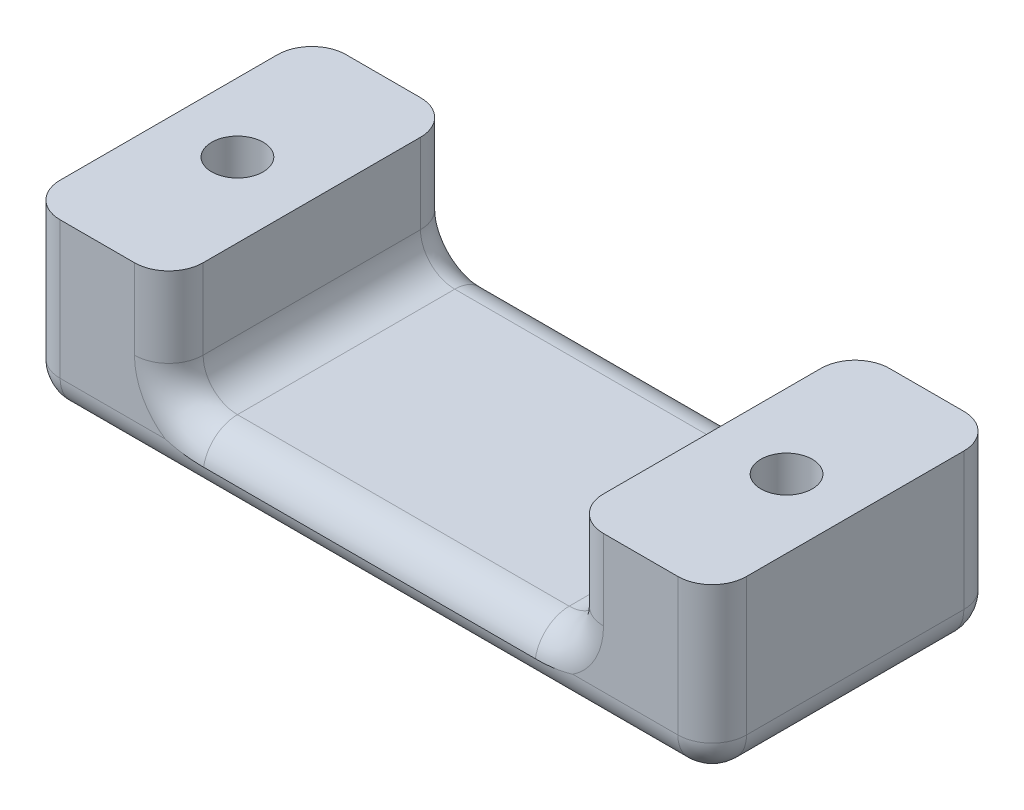
from build123d import *

# Parameters (mm, degrees)
SKETCH1_W           = 60
SKETCH1_H           = 25
BOSS_EXTRUDE1_DEPTH = 5
SKETCH2_W           = 12.5
SKETCH2_H           = 25
BOSS_EXTRUDE2_DEPTH = 10
SKETCH3_R           = 2.25
CUT_EXTRUDE1_DEPTH  = 15
FILLET1_R           = 3


with BuildPart() as part:
    # Sketch1 → Boss-Extrude1 (new body)
    with BuildSketch(Plane(origin=(0, 0, 0), x_dir=(1, 0, 0), z_dir=(0, 1, 0))):
        with Locations((30, 12.5)):
            Rectangle(SKETCH1_W, SKETCH1_H)
    extrude(amount=BOSS_EXTRUDE1_DEPTH)

    # Sketch2 → Boss-Extrude2 (add)
    with BuildSketch(Plane(origin=(0, 5, 0), x_dir=(1, 0, 0), z_dir=(0, 1, 0))):
        with Locations((6.25, 12.5)):
            Rectangle(SKETCH2_W, SKETCH2_H)
        with Locations((53.75, 12.5)):
            Rectangle(SKETCH2_W, SKETCH2_H)
    extrude(amount=BOSS_EXTRUDE2_DEPTH)

    # Sketch3 → Cut-Extrude1 (cut)
    with BuildSketch(Plane.XZ):
        with Locations(Location((6, -12.5, 0), (0, 0, 270))):
            Circle(SKETCH3_R)
        with Locations(Location((54, -12.5, 0), (0, 0, 90))):
            Circle(SKETCH3_R)
    extrude(amount=-CUT_EXTRUDE1_DEPTH, mode=Mode.SUBTRACT)

    # Fillet1
    # the kernel refuses this fillet: 3 mm, written as the material it adds along each edge
    with BuildSketch(Plane(origin=(12.5, 5, -25), x_dir=(0, 1, 0), z_dir=(0, 0, 1)), Plane(origin=(47.5, 5, -25), x_dir=(-1, 0, 0), z_dir=(0, 0, 1))) as fillet1_piece_1:
        with BuildLine():
            CenterArc((FILLET1_R, -FILLET1_R), FILLET1_R, 90, 90)
            Line((0, -FILLET1_R), (0, 0))
            Line((0, 0), (FILLET1_R, 0))
        make_face()
    extrude(amount=25)
    # the kernel refuses this fillet: 3 mm, written as the material it takes off along each edge
    with BuildSketch(Plane(origin=(57, 3, -22), x_dir=(0, 0, -1), z_dir=(0, -1, 0))) as fillet1_2_piece_1_section:
        Polygon((0, 0), (FILLET1_R * 1.02, 0), (FILLET1_R * 1.02, FILLET1_R * 1.02), (0, FILLET1_R * 1.02), align=None)
    fillet1_2_piece_1 = extrude(amount=FILLET1_R * 1.02, mode=Mode.PRIVATE)
    fillet1_2_piece_1 = fillet1_2_piece_1 - Plane(origin=(57, 3, -22), x_dir=(-0.7071067811865475, 0, 0.7071067811865475), z_dir=(0, -1, 0)) * Sphere(FILLET1_R, mode=Mode.PRIVATE)
    add(fillet1_2_piece_1, mode=Mode.SUBTRACT)
    with BuildSketch(Plane(origin=(3, 3, -22), x_dir=(0, 0, -1), z_dir=(0, -1, 0))) as fillet1_2_piece_2_section:
        Polygon((0, 0), (FILLET1_R * 1.02, 0), (FILLET1_R * 1.02, -FILLET1_R * 1.02), (0, -FILLET1_R * 1.02), align=None)
    fillet1_2_piece_2 = extrude(amount=FILLET1_R * 1.02, mode=Mode.PRIVATE)
    fillet1_2_piece_2 = fillet1_2_piece_2 - Plane(origin=(3, 3, -22), x_dir=(0.7071067811865475, 0, 0.7071067811865475), z_dir=(0, -1, 0)) * Sphere(FILLET1_R, mode=Mode.PRIVATE)
    add(fillet1_2_piece_2, mode=Mode.SUBTRACT)
    with BuildSketch(Plane(origin=(57, 3, -3), x_dir=(0, 0, 1), z_dir=(0, -1, 0))) as fillet1_2_piece_3_section:
        Polygon((0, 0), (FILLET1_R * 1.02, 0), (FILLET1_R * 1.02, -FILLET1_R * 1.02), (0, -FILLET1_R * 1.02), align=None)
    fillet1_2_piece_3 = extrude(amount=FILLET1_R * 1.02, mode=Mode.PRIVATE)
    fillet1_2_piece_3 = fillet1_2_piece_3 - Plane(origin=(57, 3, -3), x_dir=(-0.7071067811865475, 0, -0.7071067811865475), z_dir=(0, -1, 0)) * Sphere(FILLET1_R, mode=Mode.PRIVATE)
    add(fillet1_2_piece_3, mode=Mode.SUBTRACT)
    with BuildSketch(Plane(origin=(3, 3, -3), x_dir=(0, -1, 0), z_dir=(0, 0, 1))) as fillet1_2_piece_4_section:
        Polygon((0, 0), (FILLET1_R * 1.02, 0), (FILLET1_R * 1.02, -FILLET1_R * 1.02), (0, -FILLET1_R * 1.02), align=None)
    fillet1_2_piece_4 = extrude(amount=FILLET1_R * 1.02, mode=Mode.PRIVATE)
    fillet1_2_piece_4 = fillet1_2_piece_4 - Plane(origin=(3, 3, -3), x_dir=(0.7071067811865475, 0.7071067811865475, 0), z_dir=(0, 0, 1)) * Sphere(FILLET1_R, mode=Mode.PRIVATE)
    add(fillet1_2_piece_4, mode=Mode.SUBTRACT)
    with BuildSketch(Plane(origin=(57, 0, -25), x_dir=(0, 0, 1), z_dir=(-1, 0, 0))) as fillet1_2_piece_5:
        with BuildLine():
            CenterArc((FILLET1_R, FILLET1_R), FILLET1_R, 180, 90)
            Line((0, FILLET1_R), (0, 0))
            Line((0, 0), (FILLET1_R, 0))
        make_face()
    extrude(amount=54, mode=Mode.SUBTRACT)
    with BuildSketch(Plane(origin=(60, 0, -3), x_dir=(0, 1, 0), z_dir=(0, 0, -1)), Plane(origin=(0, 0, -22), x_dir=(0, 1, 0), z_dir=(0, 0, 1))) as fillet1_2_piece_6:
        with BuildLine():
            CenterArc((FILLET1_R, -FILLET1_R), FILLET1_R, 90, 90)
            Line((0, -FILLET1_R), (0, 0))
            Line((0, 0), (FILLET1_R, 0))
        make_face()
    extrude(amount=19, mode=Mode.SUBTRACT)
    with BuildSketch(Plane(origin=(3, 0, 0), x_dir=(0, 1, 0), z_dir=(1, 0, 0))) as fillet1_2_piece_7:
        with BuildLine():
            CenterArc((FILLET1_R, -FILLET1_R), FILLET1_R, 90, 90)
            Line((0, -FILLET1_R), (0, 0))
            Line((0, 0), (FILLET1_R, 0))
        make_face()
    extrude(amount=54, mode=Mode.SUBTRACT)
    with BuildSketch(Plane(origin=(0, 22.5, -25), x_dir=(0, 0, 1), z_dir=(0, -1, 0)), Plane(origin=(60, 3, -25), x_dir=(0, 0, 1), z_dir=(0, 1, 0)), Plane(origin=(60, 3, 0), x_dir=(-1, 0, 0), z_dir=(0, 1, 0)), Plane(origin=(0, 22.5, 0), x_dir=(1, 0, 0), z_dir=(0, -1, 0))) as fillet1_2_piece_8:
        with BuildLine():
            CenterArc((FILLET1_R, -FILLET1_R), FILLET1_R, 90, 90)
            Line((0, -FILLET1_R), (0, 0))
            Line((0, 0), (FILLET1_R, 0))
        make_face()
    extrude(amount=19.5, mode=Mode.SUBTRACT)
    # the kernel refuses this fillet: 3 mm, written as the material it takes off along each edge
    with BuildSketch(Plane(origin=(15.5, 5, 0), x_dir=(0, -1, 0), z_dir=(1, 0, 0))) as fillet1_3_piece_1:
        with BuildLine():
            CenterArc((FILLET1_R, FILLET1_R), FILLET1_R, 180, 90)
            Line((0, FILLET1_R), (0, 0))
            Line((0, 0), (FILLET1_R, 0))
        make_face()
    extrude(amount=29, mode=Mode.SUBTRACT)
    with BuildSketch(Plane(origin=(12.5, 8, 0), x_dir=(-1, 0, 0), z_dir=(0, 1, 0)), Plane(origin=(12.5, 8, -25), x_dir=(0, 0, 1), z_dir=(0, 1, 0))) as fillet1_3_piece_2:
        with BuildLine():
            CenterArc((FILLET1_R, -FILLET1_R), FILLET1_R, 90, 90)
            Line((0, -FILLET1_R), (0, 0))
            Line((0, 0), (FILLET1_R, 0))
        make_face()
    extrude(amount=14.5, mode=Mode.SUBTRACT)
    with BuildSketch(Plane(origin=(44.5, 5, -25), x_dir=(0, 0, 1), z_dir=(-1, 0, 0))) as fillet1_3_piece_3:
        with BuildLine():
            CenterArc((FILLET1_R, -FILLET1_R), FILLET1_R, 90, 90)
            Line((0, -FILLET1_R), (0, 0))
            Line((0, 0), (FILLET1_R, 0))
        make_face()
    extrude(amount=29, mode=Mode.SUBTRACT)
    with BuildSketch(Plane(origin=(47.5, 8, -25), x_dir=(0, 0, 1), z_dir=(0, 1, 0)), Plane(origin=(47.5, 8, 0), x_dir=(1, 0, 0), z_dir=(0, 1, 0))) as fillet1_3_piece_4:
        with BuildLine():
            CenterArc((FILLET1_R, FILLET1_R), FILLET1_R, 180, 90)
            Line((0, FILLET1_R), (0, 0))
            Line((0, 0), (FILLET1_R, 0))
        make_face()
    extrude(amount=14.5, mode=Mode.SUBTRACT)
    with BuildSketch(Plane(origin=(44.5, 8, 0), x_dir=(0, -1, 0), z_dir=(-1, 0, 0))) as fillet1_3_piece_5:
        with BuildLine():
            CenterArc((3 + FILLET1_R, -FILLET1_R), FILLET1_R, 90, 90)
            Line((3, -FILLET1_R), (3, 0))
            Line((3, 0), (3 + FILLET1_R, 0))
        make_face()
    revolve(axis=Axis((44.5, 8, 0), (0, 0, 1)), revolution_arc=90, mode=Mode.SUBTRACT)
    with BuildSketch(Plane(origin=(44.5, 8, -25), x_dir=(0, -1, 0), z_dir=(-1, 0, 0))) as fillet1_3_piece_6:
        with BuildLine():
            CenterArc((3 + FILLET1_R, FILLET1_R), FILLET1_R, 180, 90)
            Line((3 + FILLET1_R, 0), (3, 0))
            Line((3, 0), (3, FILLET1_R))
        make_face()
    revolve(axis=Axis((44.5, 8, -25), (0, 0, 1)), revolution_arc=90, mode=Mode.SUBTRACT)
    with BuildSketch(Plane(origin=(15.5, 8, -25), x_dir=(-1, 0, 0), z_dir=(0, 1, 0))) as fillet1_3_piece_7:
        with BuildLine():
            CenterArc((3 + FILLET1_R, FILLET1_R), FILLET1_R, 180, 90)
            Line((3 + FILLET1_R, 0), (3, 0))
            Line((3, 0), (3, FILLET1_R))
        make_face()
    revolve(axis=Axis((15.5, 8, -25), (0, 0, 1)), revolution_arc=90, mode=Mode.SUBTRACT)
    with BuildSketch(Plane(origin=(15.5, 8, 0), x_dir=(-1, 0, 0), z_dir=(0, 1, 0))) as fillet1_3_piece_8:
        with BuildLine():
            CenterArc((3 + FILLET1_R, -FILLET1_R), FILLET1_R, 90, 90)
            Line((3, -FILLET1_R), (3, 0))
            Line((3, 0), (3 + FILLET1_R, 0))
        make_face()
    revolve(axis=Axis((15.5, 8, 0), (0, 0, 1)), revolution_arc=90, mode=Mode.SUBTRACT)


solid = part.part
